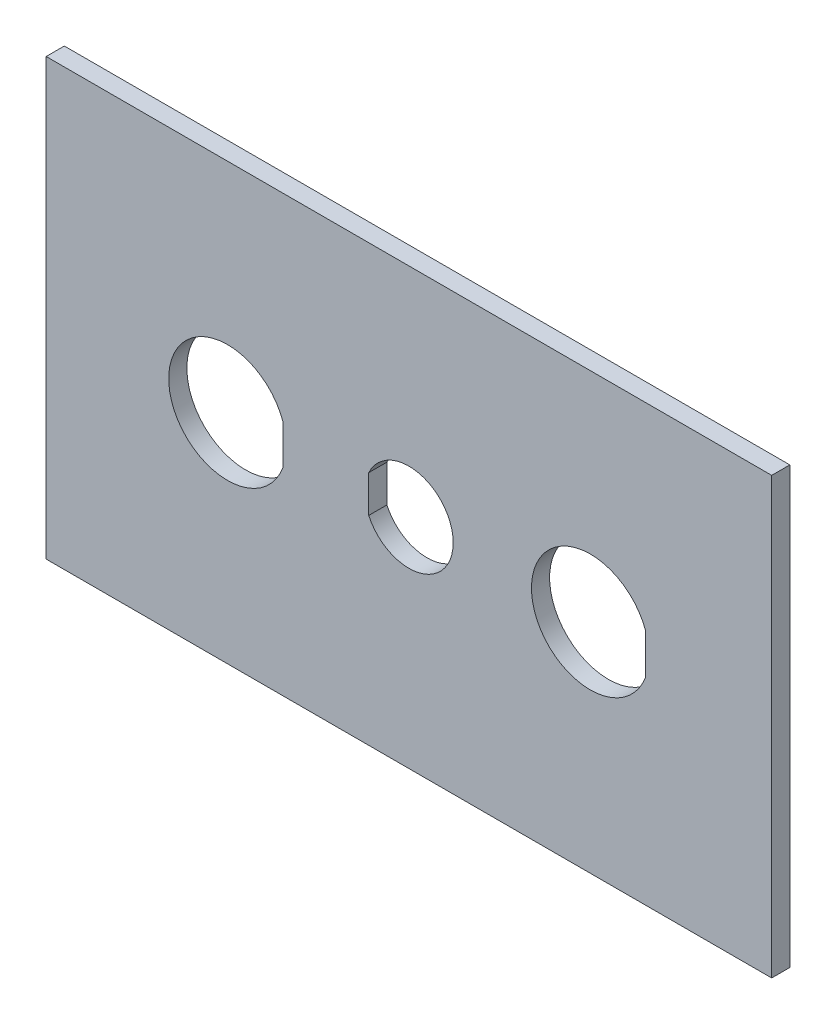
from build123d import *

# Parameters (mm, degrees)
SKETCH1_W           = 127
SKETCH1_H           = 76.2
BOSS_EXTRUDE1_DEPTH = 3.175


with BuildPart() as part:
    # Sketch1 → Boss-Extrude1 (new body)
    with BuildSketch(Plane.XY):
        Rectangle(SKETCH1_W, SKETCH1_H)
        with BuildLine():
            Line((-7.0358, 3.242456994), (-7.0358, -3.242456994))
            ThreePointArc((-7.0358, -3.242456994), (7.747, 0), (-7.0358, 3.242456994))
        make_face(mode=Mode.SUBTRACT)
        with BuildLine():
            Line((41.45, 3.464101615), (41.45, -3.464101615))
            ThreePointArc((41.45, -3.464101615), (21.45, 0), (41.45, 3.464101615))
        make_face(mode=Mode.SUBTRACT)
        with BuildLine():
            Line((-22.05, 3.464101615), (-22.05, -3.464101615))
            ThreePointArc((-22.05, -3.464101615), (-42.05, 0), (-22.05, 3.464101615))
        make_face(mode=Mode.SUBTRACT)
    extrude(amount=BOSS_EXTRUDE1_DEPTH)


solid = part.part
